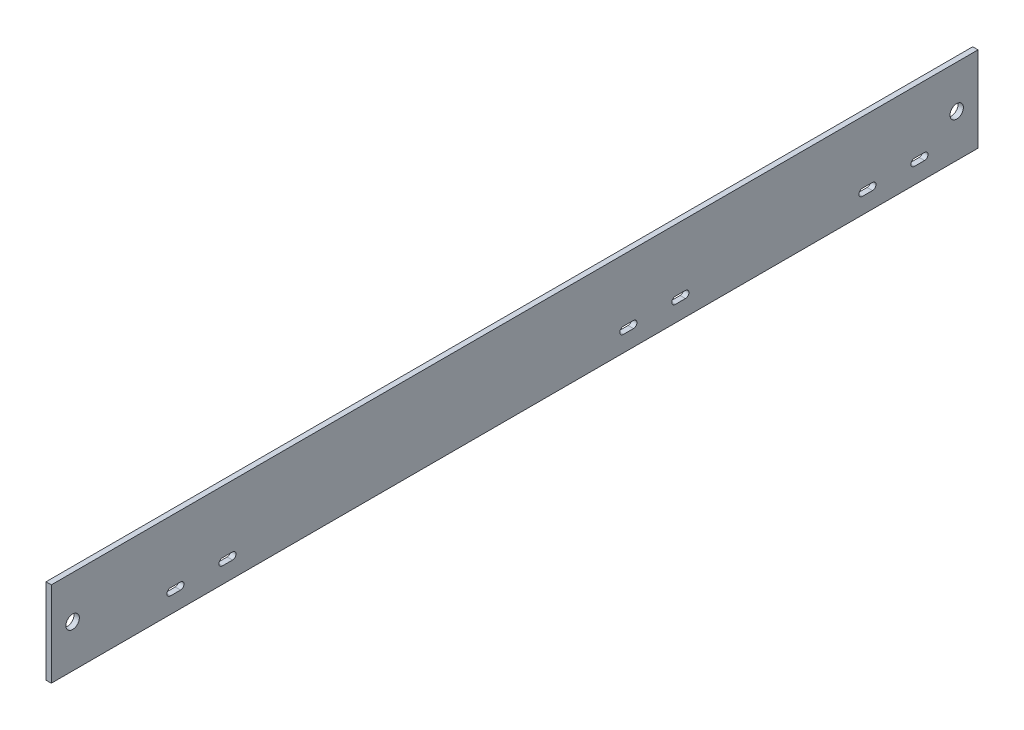
from build123d import *

# Parameters (mm, degrees)
SKETCH1_W           = 552.45
SKETCH1_H           = 50.8
SKETCH1_R           = 4
BOSS_EXTRUDE2_DEPTH = 3.175


with BuildPart() as part:
    # Sketch1 → Boss-Extrude2 (new body)
    with BuildSketch(Plane(origin=(0, 0, 0), x_dir=(0, 0, -1), z_dir=(1, 0, 0))):
        with Locations((276.225, 25.4)):
            Rectangle(SKETCH1_W, SKETCH1_H)
        with Locations((12.7, 25.4)):
            Circle(SKETCH1_R, mode=Mode.SUBTRACT)
        with Locations((539.75, 25.4)):
            Circle(SKETCH1_R, mode=Mode.SUBTRACT)
        with BuildLine():
            Line((71.025, 13.8), (77.025, 13.8))
            ThreePointArc((77.025, 13.8), (79.125, 11.7), (77.025, 9.6))
            Line((77.025, 9.6), (71.025, 9.6))
            ThreePointArc((71.025, 9.6), (68.925, 11.7), (71.025, 13.8))
        make_face(mode=Mode.SUBTRACT)
        with BuildLine():
            Line((102.025, 13.8), (108.025, 13.8))
            ThreePointArc((108.025, 13.8), (110.125, 11.7), (108.025, 9.6))
            Line((108.025, 9.6), (102.025, 9.6))
            ThreePointArc((102.025, 9.6), (99.925, 11.7), (102.025, 13.8))
        make_face(mode=Mode.SUBTRACT)
        with BuildLine():
            Line((341.025, 13.8), (347.025, 13.8))
            ThreePointArc((347.025, 13.8), (349.125, 11.7), (347.025, 9.6))
            Line((347.025, 9.6), (341.025, 9.6))
            ThreePointArc((341.025, 9.6), (338.925, 11.7), (341.025, 13.8))
        make_face(mode=Mode.SUBTRACT)
        with BuildLine():
            Line((372.025, 13.8), (378.025, 13.8))
            ThreePointArc((378.025, 13.8), (380.125, 11.7), (378.025, 9.6))
            Line((378.025, 9.6), (372.025, 9.6))
            ThreePointArc((372.025, 9.6), (369.925, 11.7), (372.025, 13.8))
        make_face(mode=Mode.SUBTRACT)
        with BuildLine():
            Line((483.55, 13.8), (489.55, 13.8))
            ThreePointArc((489.55, 13.8), (491.65, 11.7), (489.55, 9.6))
            Line((489.55, 9.6), (483.55, 9.6))
            ThreePointArc((483.55, 9.6), (481.45, 11.7), (483.55, 13.8))
        make_face(mode=Mode.SUBTRACT)
        with BuildLine():
            Line((514.55, 13.8), (520.55, 13.8))
            ThreePointArc((520.55, 13.8), (522.65, 11.7), (520.55, 9.6))
            Line((520.55, 9.6), (514.55, 9.6))
            ThreePointArc((514.55, 9.6), (512.45, 11.7), (514.55, 13.8))
        make_face(mode=Mode.SUBTRACT)
    extrude(amount=BOSS_EXTRUDE2_DEPTH)


solid = part.part
